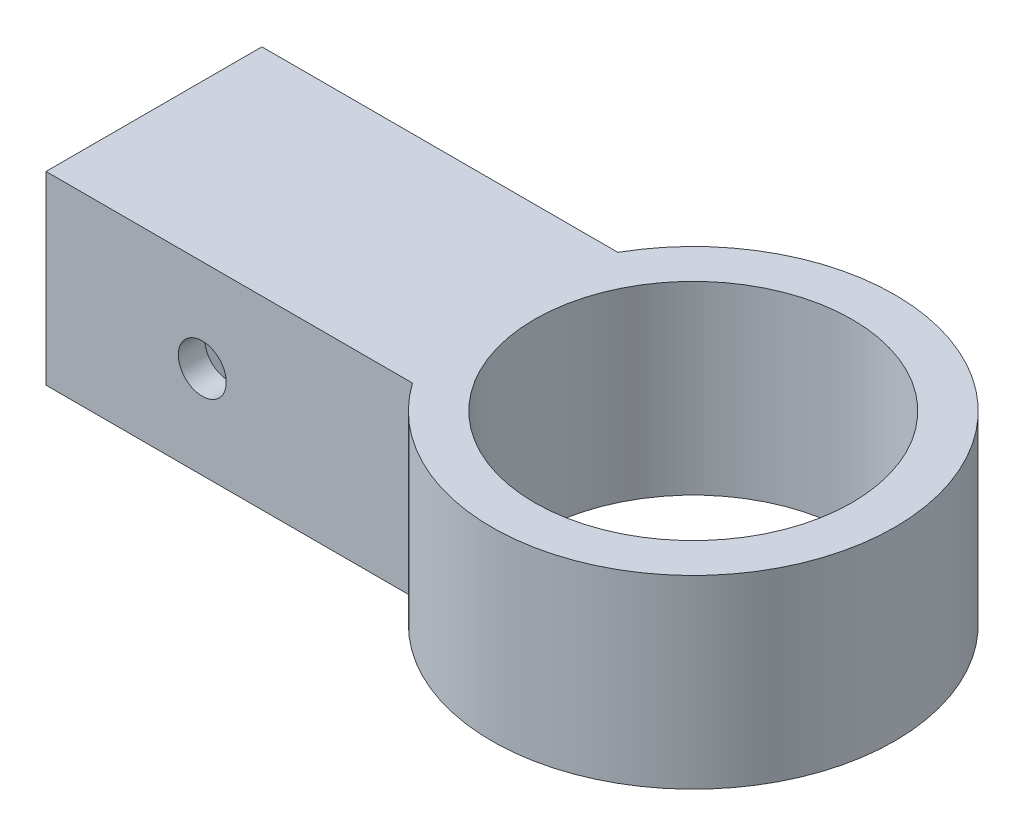
from build123d import *

# Parameters (mm, degrees)
ESBO_O2_R                = 11.15
RESSALTO_EXTRUS_O1_DEPTH = 13
ESBO_O3_W                = 7
ESBO_O3_H                = 7
CORTE_EXTRUS_O1_DEPTH    = 26
CORTE_EXTRUS_O2_DEPTH    = 2.8
ESBO_O10_R               = 1.683661958
CORTE_EXTRUS_O3_DEPTH    = 2.8


with BuildPart() as part:
    # Esboço2 → Ressalto-extrusão1 (new body)
    with BuildSketch(Plane(origin=(0, 0, 0), x_dir=(1, 0, 0), z_dir=(0, 1, 0))):
        with BuildLine():
            Line((-12.297255791, 7), (-37.297255791, 7))
            Line((-37.297255791, 7), (-37.297255791, -8.161034979))
            Line((-37.297255791, -8.161034979), (-11.559412099, -8.161034979))
            ThreePointArc((-11.559412099, -8.161034979), (14.133272661, 0.687825475), (-12.297255791, 7))
        make_face()
        Circle(ESBO_O2_R, mode=Mode.SUBTRACT)
    extrude(amount=RESSALTO_EXTRUS_O1_DEPTH)

    # Esboço3 → Corte-extrusão1 (cut)
    with BuildSketch(Plane.ZY.offset(37.297255791)):
        with Locations((0, 6.5)):
            Rectangle(ESBO_O3_W, ESBO_O3_H)
    extrude(amount=-CORTE_EXTRUS_O1_DEPTH, mode=Mode.SUBTRACT)

    # Esboço7 → Corte-extrusão2 (cut)
    with BuildSketch(Plane(origin=(0, 0, 3.5), x_dir=(-1, 0, 0), z_dir=(0, 0, -1))):
        Polygon((22.62619922, 6.5), (24.473720081, 3.3), (28.168761804, 3.3), (30.016282665, 6.5), (28.168761804, 9.7), (24.473720081, 9.7), align=None)
    extrude(amount=-CORTE_EXTRUS_O2_DEPTH, mode=Mode.SUBTRACT)

    # Esboço10 → Corte-extrusão3 (cut)
    with BuildSketch(Plane(origin=(0, 0, 6.3), x_dir=(-1, 0, 0), z_dir=(0, 0, -1))):
        with Locations((26.321240942, 6.5)):
            Circle(ESBO_O10_R)
    extrude(amount=-CORTE_EXTRUS_O3_DEPTH, mode=Mode.SUBTRACT)


solid = part.part
